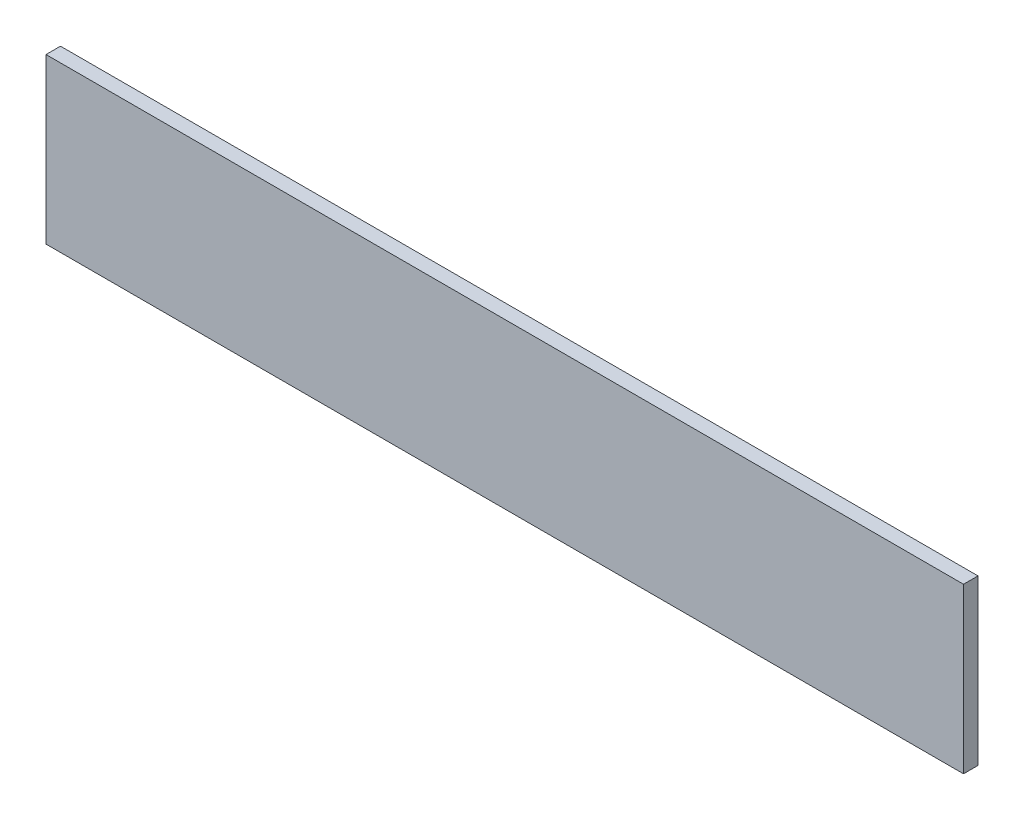
from build123d import *

# Parameters (mm, degrees)
SKETCH1_W          = 190
SKETCH1_H          = 34
BASE_FLANGE1_DEPTH = 3


# Sheet-metal steps are written as plain solids
with BuildPart() as part:
    # Sketch1 → Base-Flange1 (new body)
    with BuildSketch(Plane.XY):
        with Locations((95, 17)):
            Rectangle(SKETCH1_W, SKETCH1_H)
    extrude(amount=-BASE_FLANGE1_DEPTH)


solid = part.part
